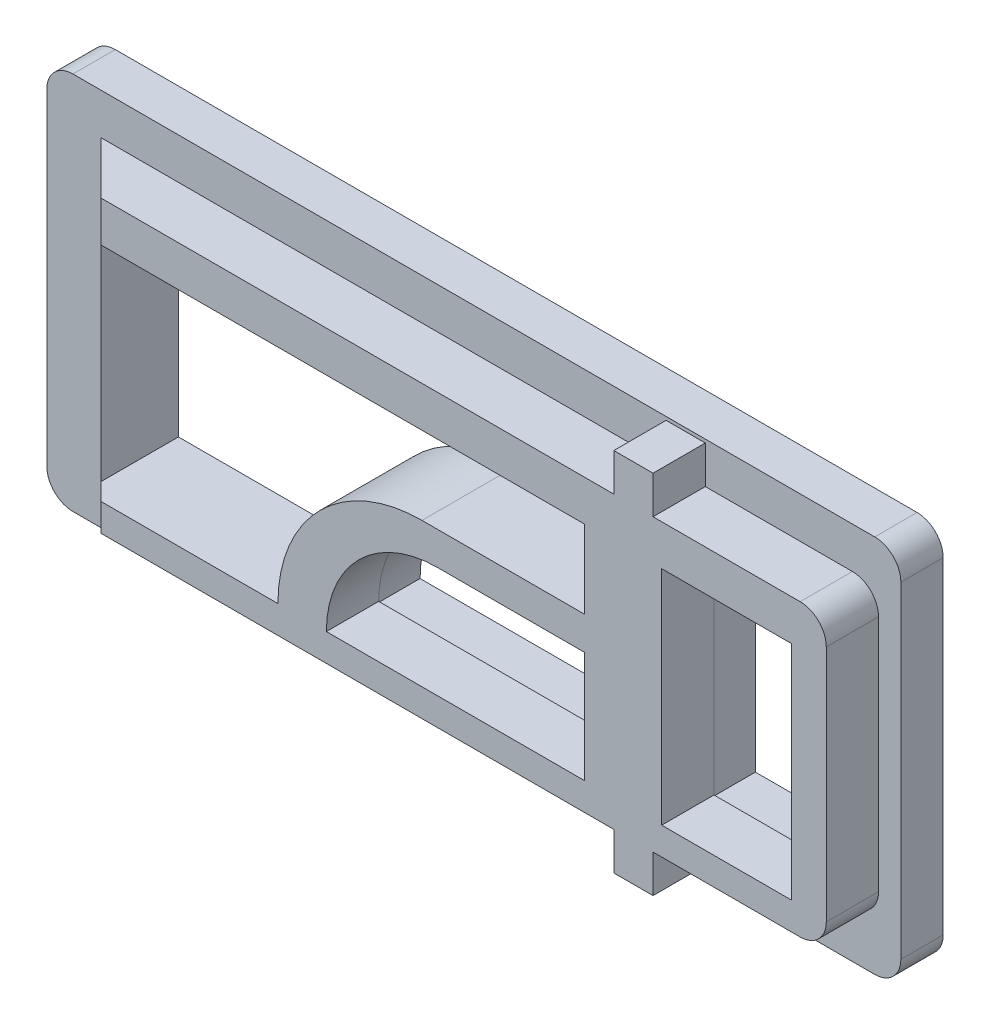
from build123d import *

# Parameters (mm, degrees)
SKETCH1_W           = 32.68
SKETCH1_H           = 14.5
BOSS_EXTRUDE2_DEPTH = 1.62
SKETCH3_W           = 4.962331447
SKETCH3_H           = 8.5
SKETCH3_W_2         = 1.5
SKETCH3_H_2         = 1.444155173
SKETCH3_H_3         = 1.444155172
BOSS_EXTRUDE3_DEPTH = 2
CUT_EXTRUDE1_START  = -2
SKETCH4_W           = 4.962331446
SKETCH4_H           = 8.5
CUT_EXTRUDE1_DEPTH  = 2
FILLET1_R           = 1
CHAMFER1_SIZE       = 2.3


with BuildPart() as part:
    # Sketch1 → Boss-Extrude2 (new body)
    with BuildSketch(Plane.XY):
        Rectangle(SKETCH1_W, SKETCH1_H)
    extrude(amount=-BOSS_EXTRUDE2_DEPTH)

    # Sketch3 → Boss-Extrude3 (add)
    # profile 1 of 3: a face of its own
    with BuildSketch(Plane.XY):
        Polygon((7.357218521, 5.676374473), (-14.565223124, 5.676374473), (-14.565223124, -5.435315182), (7.357218521, -5.435315182), (8.857218521, -5.435315182), (15.486501014, -5.435315182), (15.486501014, 5.676374473), (8.857218521, 5.676374473), align=None)
        with BuildLine():
            Line((6.231943334, 4.121127688), (6.231943334, 2.506027416))
            Line((6.231943334, 2.506027416), (6.231943334, 1.135297756))
            Line((6.231943334, 1.135297756), (0.017218521, 1.135297756))
            ThreePointArc((0.017218521, 1.135297756), (-3.881888527, -0.479765264), (-5.496951548, -4.378872312))
            Line((-5.496951548, -4.378872312), (-12.923950607, -4.378872312))
            Line((-12.923950607, -4.378872312), (-12.923950607, 4.121127688))
            Line((-12.923950607, 4.121127688), (6.231943334, 4.121127688))
        make_face(mode=Mode.SUBTRACT)
        with BuildLine():
            Line((6.231943334, -0.128872312), (6.231943334, -4.378872312))
            Line((6.231943334, -4.378872312), (-3.642781479, -4.378872312))
            ThreePointArc((-3.642781479, -4.378872312), (-2.397985299, -1.373668492), (0.607218521, -0.128872312))
            Line((0.607218521, -0.128872312), (6.231943334, -0.128872312))
        make_face(mode=Mode.SUBTRACT)
        with Locations((11.670056084, -0.128872312)):
            Rectangle(SKETCH3_W, SKETCH3_H, mode=Mode.SUBTRACT)
    # profile 2 of 3: a face of its own
    with BuildSketch(Plane.XY):
        with Locations((8.107218521, -6.157392769)):
            Rectangle(SKETCH3_W_2, SKETCH3_H_2)
    # profile 3 of 3: a face of its own
    with BuildSketch(Plane.XY):
        with Locations((8.107218521, 6.398452059)):
            Rectangle(SKETCH3_W_2, SKETCH3_H_3)
    extrude(amount=BOSS_EXTRUDE3_DEPTH)

    # Sketch4 → Cut-Extrude1 (cut)
    with BuildSketch(Plane.XY.offset(CUT_EXTRUDE1_START)):
        with BuildLine():
            Line((6.197506292, 1.135297756), (6.197506292, 2.437153333))
            Line((6.197506292, 2.437153333), (6.197506292, 4.052253605))
            Line((6.197506292, 4.052253605), (-12.923950607, 4.052253605))
            Line((-12.923950607, 4.052253605), (-12.923950607, -4.378872312))
            Line((-12.923950607, -4.378872312), (-5.530958441, -4.378872312))
            ThreePointArc((-5.530958441, -4.378872312), (-5.371289583, -3.128657844), (-4.931903418, -1.947357645))
            ThreePointArc((-4.931903418, -1.947357645), (-2.898110461, 0.301611474), (0.017218521, 1.135297756))
            Line((0.017218521, 1.135297756), (6.197506292, 1.135297756))
        make_face()
        with BuildLine():
            ThreePointArc((-3.677218521, -4.447746395), (-2.432422341, -1.442542575), (0.572781479, -0.197746395))
            Line((0.572781479, -0.197746395), (6.197506292, -0.197746395))
            Line((6.197506292, -0.197746395), (6.197506292, -4.447746395))
            Line((6.197506292, -4.447746395), (-3.677218521, -4.447746395))
        make_face()
        with Locations((11.635619042, -0.197746395)):
            Rectangle(SKETCH4_W, SKETCH4_H)
    extrude(amount=CUT_EXTRUDE1_DEPTH, mode=Mode.SUBTRACT)

    # Fillet1
    fillet1_edges = [part.edges().sort_by_distance(p)[0] for p in [
        (15.486501014, -5.435315182, 1),
        (15.486501014, 5.676374473, 1),
        (16.34, -7.25, -0.81),
        (-16.34, -7.25, -0.81),
        (-16.34, 7.25, -0.81),
        (16.34, 7.25, -0.81),
    ]]
    fillet(fillet1_edges, radius=FILLET1_R)

    # Chamfer1
    # the kernel refuses this chamfer: 2.3 mm, written as the material it takes off along each edge
    with BuildSketch(Plane(origin=(-14.565223124, 11.591245345, 2), x_dir=(-0.02749587661058623, 0, -0.9996219169112968), z_dir=(0, -1, 0))) as chamfer1_piece_1_section:
        Polygon((CHAMFER1_SIZE * 0.999621916911, CHAMFER1_SIZE * 0.0274958766106), (-CHAMFER1_SIZE * 0.0274958766106, CHAMFER1_SIZE * 0.999621916911), (0, 0), align=None)
    chamfer1_piece_1 = extrude(amount=22.9414314, mode=Mode.PRIVATE)
    chamfer1_piece_1 = split(chamfer1_piece_1, bisect_by=Plane(origin=(-13.786723821, 0.120529645, 0), z_dir=(0, 0, 1)), keep=Keep.TOP, mode=Mode.PRIVATE)
    add(chamfer1_piece_1, mode=Mode.SUBTRACT)


solid = part.part
